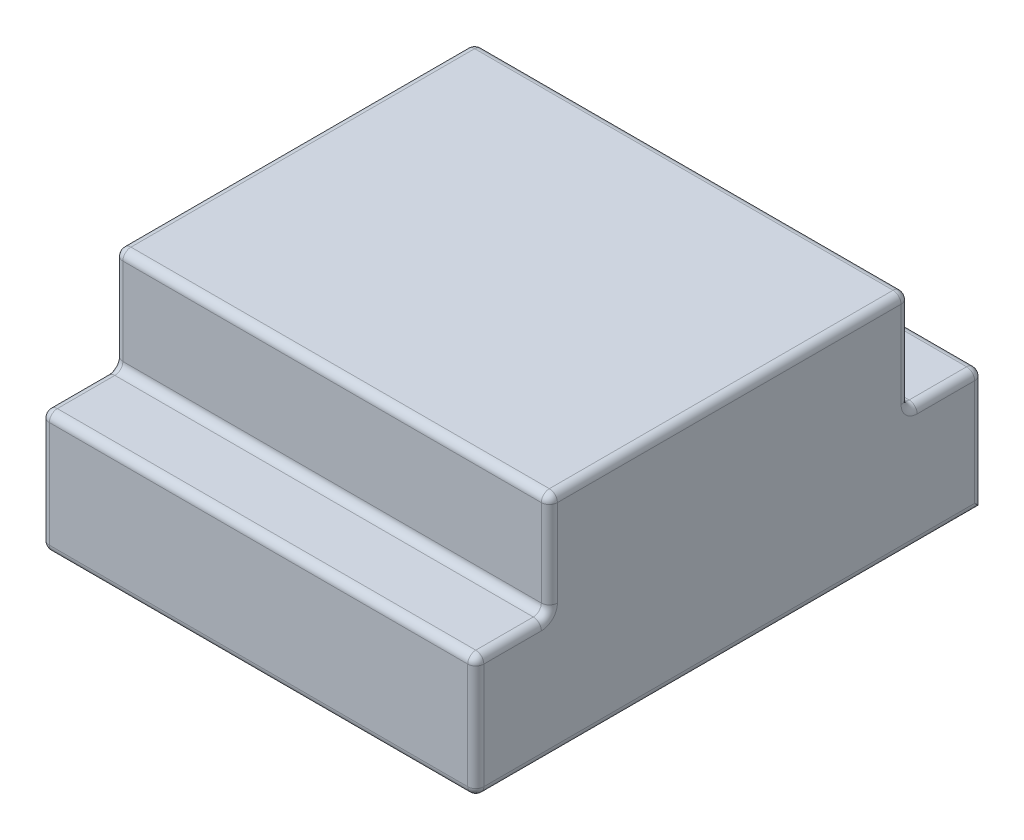
from build123d import *

# Parameters (mm, degrees)
SKETCH1_W               = 137.16
SKETCH1_H               = 160.02
BOSS_EXTRUDE1_DEPTH     = 71.12
CUT_EXTRUDE1_DEPTH      = 174.99
CUT_EXTRUDE1_DEPTH_BACK = 174.99
SKETCH2_W               = 23.227349815
SKETCH2_H               = 32.529214904
FILLET1_R               = 2.54
FILLET2_R               = 2.54
SKETCH3_R               = 3.302
CUT_EXTRUDE2_DEPTH      = 7.62


with BuildPart() as part:
    # Sketch1 → Boss-Extrude1 (new body)
    with BuildSketch(Plane(origin=(0, 0, 0), x_dir=(1, 0, 0), z_dir=(0, 1, 0))):
        Rectangle(SKETCH1_W, SKETCH1_H)
    extrude(amount=-BOSS_EXTRUDE1_DEPTH)

    # Sketch2 → Cut-Extrude1 (cut, two sides: drawn at the far end of the back side and taken through both)
    with BuildSketch(Plane(origin=(68.58, 0, 0), x_dir=(0, 0, -1), z_dir=(1, 0, 0)).offset(-CUT_EXTRUDE1_DEPTH_BACK)):
        with Locations((-68.396325093, -16.264607452)):
            Rectangle(SKETCH2_W, SKETCH2_H)
        with Locations((68.396325093, -16.264607452)):
            Rectangle(SKETCH2_W, SKETCH2_H)
    extrude(amount=CUT_EXTRUDE1_DEPTH + CUT_EXTRUDE1_DEPTH_BACK, mode=Mode.SUBTRACT)

    # Fillet1
    fillet1_edges = [part.edges().sort_by_distance(p)[0] for p in [
        (68.58, 0, 0),
        (-68.58, 0, 0),
        (0, -71.12, 80.01),
        (68.58, -32.529214904, 68.396325092),
        (68.58, -16.264607452, 56.782650185),
        (0, -32.529214904, 80.01),
        (-68.58, -16.264607452, 56.782650185),
        (0, 0, 56.782650185),
        (-68.58, -32.529214904, 68.396325092),
        (0, -32.529214904, 56.782650185),
        (68.58, -32.529214904, -68.396325092),
        (68.58, -16.264607452, -56.782650185),
        (-68.58, -16.264607452, -56.782650185),
        (0, -32.529214904, -56.782650185),
        (0, 0, -56.782650185),
        (-68.58, -32.529214904, -68.396325092),
        (0, -32.529214904, -80.01),
        (68.58, -71.12, 0),
        (68.58, -51.824607452, 80.01),
        (-68.58, -51.824607452, 80.01),
        (68.58, -51.824607452, -80.01),
    ]]
    fillet(fillet1_edges, radius=FILLET1_R)

    # Fillet2
    # the kernel refuses this fillet: 2.54 mm, written as the material it takes off along each edge
    with BuildSketch(Plane(origin=(-66.04, -68.58, 77.47), x_dir=(-1, 0, 0), z_dir=(0, -1, 0))) as fillet2_piece_1_section:
        Polygon((0, 0), (FILLET2_R, 0), (FILLET2_R, -FILLET2_R), (0, -FILLET2_R), align=None)
    fillet2_piece_1 = extrude(amount=FILLET2_R, mode=Mode.PRIVATE)
    fillet2_piece_1 = fillet2_piece_1 - Plane(origin=(-66.04, -68.58, 77.47), x_dir=(0.7071067811865475, 0, -0.7071067811865476), z_dir=(0, -1, 0)) * Sphere(FILLET2_R, mode=Mode.PRIVATE)
    add(fillet2_piece_1, mode=Mode.SUBTRACT)
    with BuildSketch(Plane(origin=(-66.04, -35.069214904, -77.47), x_dir=(-1, 0, 0), z_dir=(0, 0, -1))) as fillet2_piece_2_section:
        Polygon((0, 0), (FILLET2_R, 0), (FILLET2_R, FILLET2_R), (0, FILLET2_R), align=None)
    fillet2_piece_2 = extrude(amount=FILLET2_R, mode=Mode.PRIVATE)
    fillet2_piece_2 = fillet2_piece_2 - Plane(origin=(-66.04, -35.069214904, -77.47), x_dir=(0.7071067811865475, -0.7071067811865475, 0), z_dir=(0, 0, -1)) * Sphere(FILLET2_R, mode=Mode.PRIVATE)
    add(fillet2_piece_2, mode=Mode.SUBTRACT)
    with BuildSketch(Plane(origin=(-68.58, -71.12, 77.47), x_dir=(1, 0, 0), z_dir=(0, 0, -1))) as fillet2_piece_3:
        with BuildLine():
            CenterArc((FILLET2_R, -FILLET2_R), FILLET2_R, 90, 90)
            Line((0, -FILLET2_R), (0, 0))
            Line((0, 0), (FILLET2_R, 0))
        make_face()
    extrude(amount=163.83, mode=Mode.SUBTRACT)
    with BuildSketch(Plane(origin=(-68.58, -35.069214904, -80.01), x_dir=(1, 0, 0), z_dir=(0, -1, 0))) as fillet2_piece_4:
        with BuildLine():
            CenterArc((FILLET2_R, FILLET2_R), FILLET2_R, 180, 90)
            Line((0, FILLET2_R), (0, 0))
            Line((0, 0), (FILLET2_R, 0))
        make_face()
    extrude(amount=42.400785096, mode=Mode.SUBTRACT)

    # Sketch3 → Cut-Extrude2 (cut)
    with BuildSketch(Plane.XZ.offset(71.12)):
        with Locations(Location((-22.2504, -57.4675, 0), (0, 0, 270))):
            Circle(SKETCH3_R)
        with Locations(Location((-22.2504, 57.4675, 0), (0, 0, 270))):
            Circle(SKETCH3_R)
        with Locations(Location((22.2504, 57.4675, 0), (0, 0, 270))):
            Circle(SKETCH3_R)
        with Locations(Location((22.2504, -57.4675, 0), (0, 0, 270))):
            Circle(SKETCH3_R)
    extrude(amount=-CUT_EXTRUDE2_DEPTH, mode=Mode.SUBTRACT)


solid = part.part
